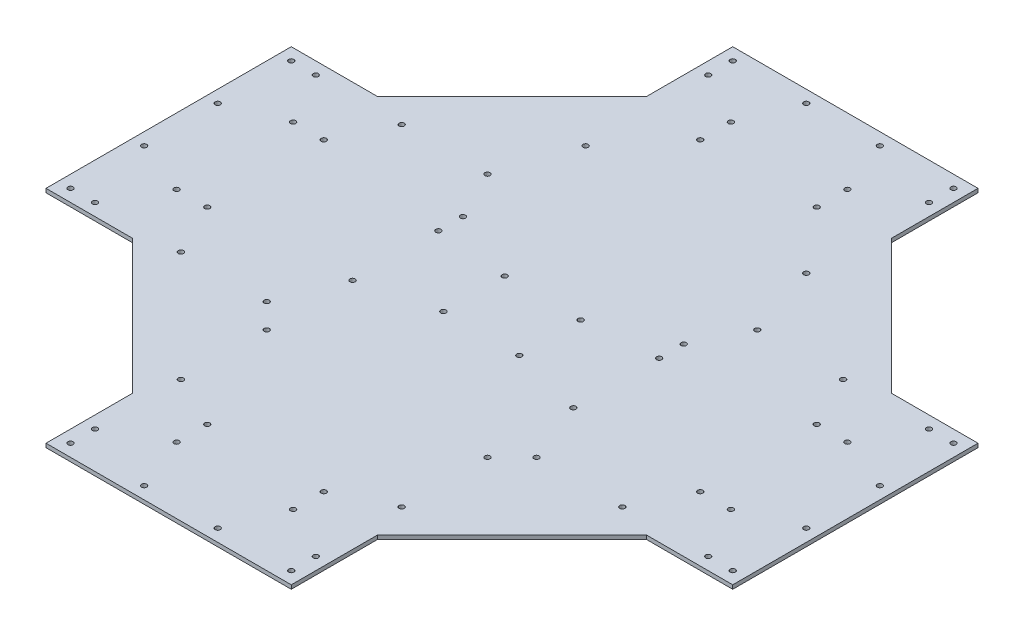
from build123d import *

# Parameters (mm, degrees)
SKETCH1_R           = 2.125
BOSS_EXTRUDE1_DEPTH = 3.175
SKETCH2_R           = 2.125
CUT_EXTRUDE1_DEPTH  = 396.992525971


with BuildPart() as part:
    # Sketch1 → Boss-Extrude1 (new body)
    with BuildSketch(Plane(origin=(0, 0, 0), x_dir=(1, 0, 0), z_dir=(0, 1, 0))):
        Polygon((-100, -280), (0, -280), (100, -280), (100, -209.601551084), (209.601551084, -100), (280, -100), (280, 0), (280, 100), (209.601551084, 100), (100, 209.601551084), (100, 280), (0, 280), (-100, 280), (-100, 209.601551084), (-209.601551084, 100), (-280, 100), (-280, 0), (-280, -100), (-209.601551084, -100), (-100, -209.601551084), align=None)
        with Locations((-90, -270)):
            Circle(SKETCH1_R, mode=Mode.SUBTRACT)
        with Locations((-90, -250)):
            Circle(SKETCH1_R, mode=Mode.SUBTRACT)
        with Locations((-30, -270)):
            Circle(SKETCH1_R, mode=Mode.SUBTRACT)
        with Locations((-47.5, -226)):
            Circle(SKETCH1_R, mode=Mode.SUBTRACT)
        with Locations((-90, -180)):
            Circle(SKETCH1_R, mode=Mode.SUBTRACT)
        with Locations((-47.5, -201)):
            Circle(SKETCH1_R, mode=Mode.SUBTRACT)
        with Locations((-270, -90)):
            Circle(SKETCH1_R, mode=Mode.SUBTRACT)
        with Locations((-250, -90)):
            Circle(SKETCH1_R, mode=Mode.SUBTRACT)
        with Locations((-180, -90)):
            Circle(SKETCH1_R, mode=Mode.SUBTRACT)
        with Locations((-226, -47.5)):
            Circle(SKETCH1_R, mode=Mode.SUBTRACT)
        with Locations((-270, -30)):
            Circle(SKETCH1_R, mode=Mode.SUBTRACT)
        with Locations((-201, -47.5)):
            Circle(SKETCH1_R, mode=Mode.SUBTRACT)
        with Locations((-90, -110)):
            Circle(SKETCH1_R, mode=Mode.SUBTRACT)
        with Locations((-110, -90)):
            Circle(SKETCH1_R, mode=Mode.SUBTRACT)
        with Locations((-90, -40)):
            Circle(SKETCH1_R, mode=Mode.SUBTRACT)
        with Locations((30, -270)):
            Circle(SKETCH1_R, mode=Mode.SUBTRACT)
        with Locations((47.5, -226)):
            Circle(SKETCH1_R, mode=Mode.SUBTRACT)
        with Locations((90, -270)):
            Circle(SKETCH1_R, mode=Mode.SUBTRACT)
        with Locations((90, -250)):
            Circle(SKETCH1_R, mode=Mode.SUBTRACT)
        with Locations((47.5, -201)):
            Circle(SKETCH1_R, mode=Mode.SUBTRACT)
        with Locations((90, -180)):
            Circle(SKETCH1_R, mode=Mode.SUBTRACT)
        with Locations((90, -110)):
            Circle(SKETCH1_R, mode=Mode.SUBTRACT)
        with Locations((110, -90)):
            Circle(SKETCH1_R, mode=Mode.SUBTRACT)
        with Locations((90, -40)):
            Circle(SKETCH1_R, mode=Mode.SUBTRACT)
        with Locations((180, -90)):
            Circle(SKETCH1_R, mode=Mode.SUBTRACT)
        with Locations((250, -90)):
            Circle(SKETCH1_R, mode=Mode.SUBTRACT)
        with Locations((270, -90)):
            Circle(SKETCH1_R, mode=Mode.SUBTRACT)
        with Locations((201, -47.5)):
            Circle(SKETCH1_R, mode=Mode.SUBTRACT)
        with Locations((226, -47.5)):
            Circle(SKETCH1_R, mode=Mode.SUBTRACT)
        with Locations((270, -30)):
            Circle(SKETCH1_R, mode=Mode.SUBTRACT)
        with Locations((-270, 30)):
            Circle(SKETCH1_R, mode=Mode.SUBTRACT)
        with Locations((-226, 47.5)):
            Circle(SKETCH1_R, mode=Mode.SUBTRACT)
        with Locations((-201, 47.5)):
            Circle(SKETCH1_R, mode=Mode.SUBTRACT)
        with Locations((-270, 90)):
            Circle(SKETCH1_R, mode=Mode.SUBTRACT)
        with Locations((-250, 90)):
            Circle(SKETCH1_R, mode=Mode.SUBTRACT)
        with Locations((-180, 90)):
            Circle(SKETCH1_R, mode=Mode.SUBTRACT)
        with Locations((-90, 30)):
            Circle(SKETCH1_R, mode=Mode.SUBTRACT)
        with Locations((-90, 50)):
            Circle(SKETCH1_R, mode=Mode.SUBTRACT)
        with Locations((-110, 90)):
            Circle(SKETCH1_R, mode=Mode.SUBTRACT)
        with Locations((-90, 150)):
            Circle(SKETCH1_R, mode=Mode.SUBTRACT)
        with Locations((-47.5, 201)):
            Circle(SKETCH1_R, mode=Mode.SUBTRACT)
        with Locations((-90, 250)):
            Circle(SKETCH1_R, mode=Mode.SUBTRACT)
        with Locations((-90, 270)):
            Circle(SKETCH1_R, mode=Mode.SUBTRACT)
        with Locations((-47.5, 226)):
            Circle(SKETCH1_R, mode=Mode.SUBTRACT)
        with Locations((-30, 270)):
            Circle(SKETCH1_R, mode=Mode.SUBTRACT)
        with Locations((90, 30)):
            Circle(SKETCH1_R, mode=Mode.SUBTRACT)
        with Locations((90, 50)):
            Circle(SKETCH1_R, mode=Mode.SUBTRACT)
        with Locations((110, 90)):
            Circle(SKETCH1_R, mode=Mode.SUBTRACT)
        with Locations((201, 47.5)):
            Circle(SKETCH1_R, mode=Mode.SUBTRACT)
        with Locations((270, 30)):
            Circle(SKETCH1_R, mode=Mode.SUBTRACT)
        with Locations((226, 47.5)):
            Circle(SKETCH1_R, mode=Mode.SUBTRACT)
        with Locations((180, 90)):
            Circle(SKETCH1_R, mode=Mode.SUBTRACT)
        with Locations((250, 90)):
            Circle(SKETCH1_R, mode=Mode.SUBTRACT)
        with Locations((270, 90)):
            Circle(SKETCH1_R, mode=Mode.SUBTRACT)
        with Locations((47.5, 201)):
            Circle(SKETCH1_R, mode=Mode.SUBTRACT)
        with Locations((90, 150)):
            Circle(SKETCH1_R, mode=Mode.SUBTRACT)
        with Locations((47.5, 226)):
            Circle(SKETCH1_R, mode=Mode.SUBTRACT)
        with Locations((30, 270)):
            Circle(SKETCH1_R, mode=Mode.SUBTRACT)
        with Locations((90, 250)):
            Circle(SKETCH1_R, mode=Mode.SUBTRACT)
        with Locations((90, 270)):
            Circle(SKETCH1_R, mode=Mode.SUBTRACT)
    extrude(amount=BOSS_EXTRUDE1_DEPTH)

    # Sketch2 → Cut-Extrude1 (cut, through all)
    with BuildSketch(Plane(origin=(0, 3.175, 0), x_dir=(1, 0, 0), z_dir=(0, 1, 0))):
        with Locations((-31, 25)):
            Circle(SKETCH2_R)
        with Locations((-31, -25)):
            Circle(SKETCH2_R)
        with Locations((31, -25)):
            Circle(SKETCH2_R)
        with Locations((31, 25)):
            Circle(SKETCH2_R)
    extrude(amount=-CUT_EXTRUDE1_DEPTH, mode=Mode.SUBTRACT)


solid = part.part
